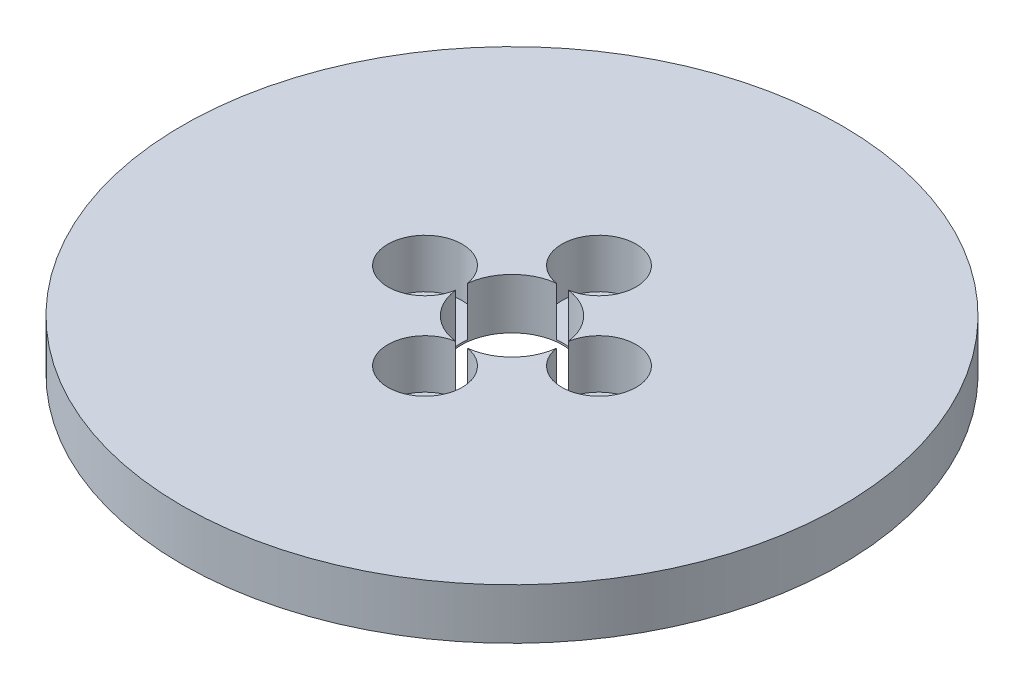
from build123d import *

# Parameters (mm, degrees)
SKETCH1_R           = 65
BOSS_EXTRUDE1_DEPTH = 10
SKETCH2_R           = 10
CUT_EXTRUDE1_DEPTH  = 93.466210045
SKETCH3_R           = 7.31893527
CUT_EXTRUDE2_DEPTH  = 9.651615618
CIRPATTERN1_COUNT   = 4


with BuildPart() as part:
    # Sketch1 → Boss-Extrude1 (new body)
    with BuildSketch(Plane(origin=(0, 0, 0), x_dir=(1, 0, 0), z_dir=(0, 1, 0))):
        Circle(SKETCH1_R)
    extrude(amount=BOSS_EXTRUDE1_DEPTH)

    # Sketch2 → Cut-Extrude1 (cut, through all)
    with BuildSketch(Plane(origin=(0, 0, 0), x_dir=(1, 0, 0), z_dir=(0, 1, 0))):
        Circle(SKETCH2_R)
    extrude(amount=CUT_EXTRUDE1_DEPTH, mode=Mode.SUBTRACT)

    # Sketch3 → Cut-Extrude2 (cut)
    with BuildSketch(Plane(origin=(0, 10, 0), x_dir=(1, 0, 0), z_dir=(0, 1, 0))):
        with Locations((-17.157051341, 0)):
            Circle(SKETCH3_R)
    cut_extrude2 = extrude(amount=-CUT_EXTRUDE2_DEPTH, mode=Mode.SUBTRACT)

    # CirPattern1: Cut-Extrude2 ×4 about axis
    cirpattern1_axis = Axis((0, 0, 0), (0, 1, 0))
    for i in range(1, CIRPATTERN1_COUNT):
        add(cut_extrude2.rotate(cirpattern1_axis, i * 360 / CIRPATTERN1_COUNT), mode=Mode.SUBTRACT)


solid = part.part
